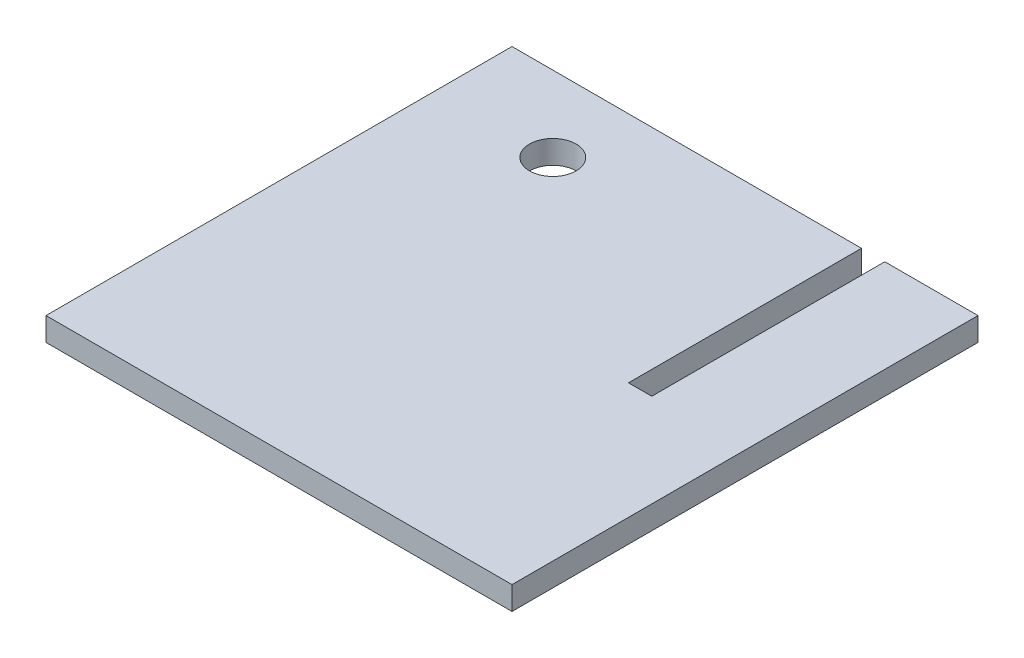
from build123d import *

# Parameters (mm, degrees)
SKETCH1_W               = 254
SKETCH1_H               = 254
BOSS_EXTRUDE1_DEPTH     = 6.35
CAVITY1_START           = -6.35
CAVITY1_OUTLINE_R       = 12.7
CAVITY1_DEPTH           = 12.7
CUT_EXTRUDE1_DEPTH      = 285.051619429
CUT_EXTRUDE1_DEPTH_BACK = 285.051619429
SKETCH2_W               = 12.7
SKETCH2_H               = 127


# Read off the part's stored shape, not the designer's step: Cavity1
with BuildPart() as part:
    # Sketch1 → Boss-Extrude1 (new, symmetric)
    with BuildSketch(Plane(origin=(0, 0, 0), x_dir=(1, 0, 0), z_dir=(0, 1, 0))):
        with Locations((0, 127)):
            Rectangle(SKETCH1_W, SKETCH1_H)
    extrude(amount=BOSS_EXTRUDE1_DEPTH, both=True)

    # Cavity1 outline → Cavity1 (cut)
    with BuildSketch(Plane(origin=(0, 0, 0), x_dir=(1, 0, 0), z_dir=(0, 1, 0)).offset(CAVITY1_START)):
        with Locations((-63.5, 212.75)):
            Circle(CAVITY1_OUTLINE_R)
    extrude(amount=CAVITY1_DEPTH, mode=Mode.SUBTRACT)

    # Sketch2 → Cut-Extrude1 (cut, two sides: drawn at the far end of the back side and taken through both)
    with BuildSketch(Plane(origin=(0, 0, 0), x_dir=(1, 0, 0), z_dir=(0, 1, 0)).offset(-CUT_EXTRUDE1_DEPTH_BACK)):
        with Locations((69.85, 190.5)):
            Rectangle(SKETCH2_W, SKETCH2_H)
    extrude(amount=CUT_EXTRUDE1_DEPTH + CUT_EXTRUDE1_DEPTH_BACK, mode=Mode.SUBTRACT)


solid = part.part
